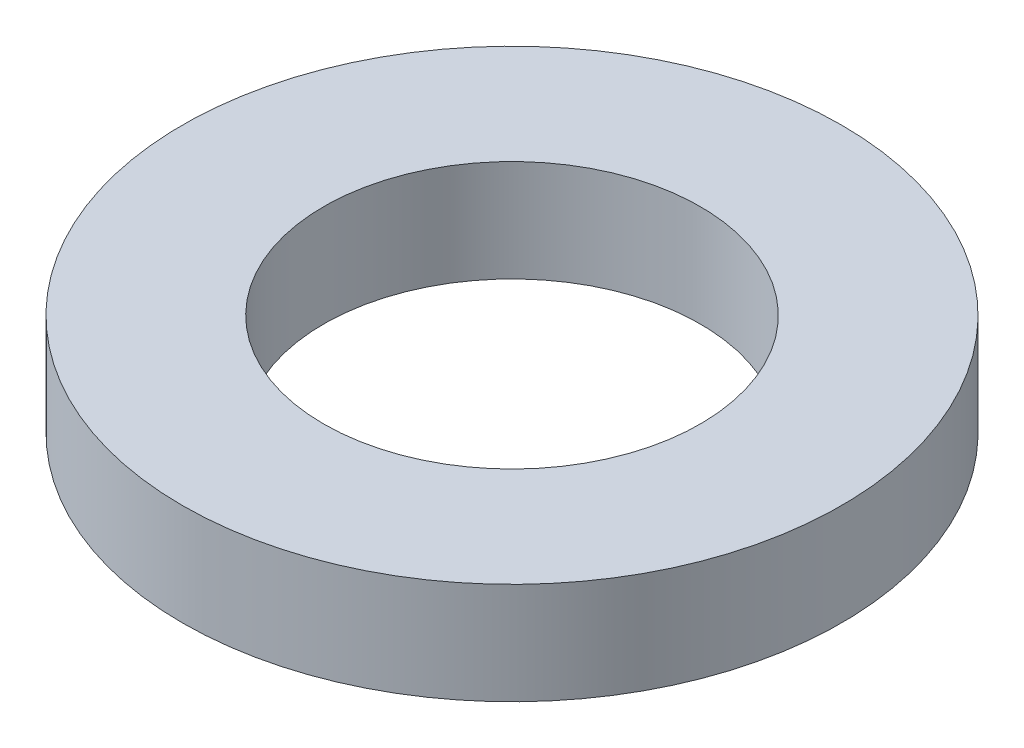
from build123d import *

# Parameters (mm, degrees)
SKETCH1_R           = 87.5
BOSS_EXTRUDE1_DEPTH = 27
SKETCH2_R           = 50
CUT_EXTRUDE1_DEPTH  = 127.655043326


with BuildPart() as part:
    # Sketch1 → Boss-Extrude1 (new body)
    with BuildSketch(Plane(origin=(0, 0, 0), x_dir=(1, 0, 0), z_dir=(0, 1, 0))):
        Circle(SKETCH1_R)
    extrude(amount=BOSS_EXTRUDE1_DEPTH)

    # Sketch2 → Cut-Extrude1 (cut, through all)
    with BuildSketch(Plane(origin=(0, 0, 0), x_dir=(1, 0, 0), z_dir=(0, 1, 0))):
        Circle(SKETCH2_R)
    extrude(amount=CUT_EXTRUDE1_DEPTH, mode=Mode.SUBTRACT)


solid = part.part
